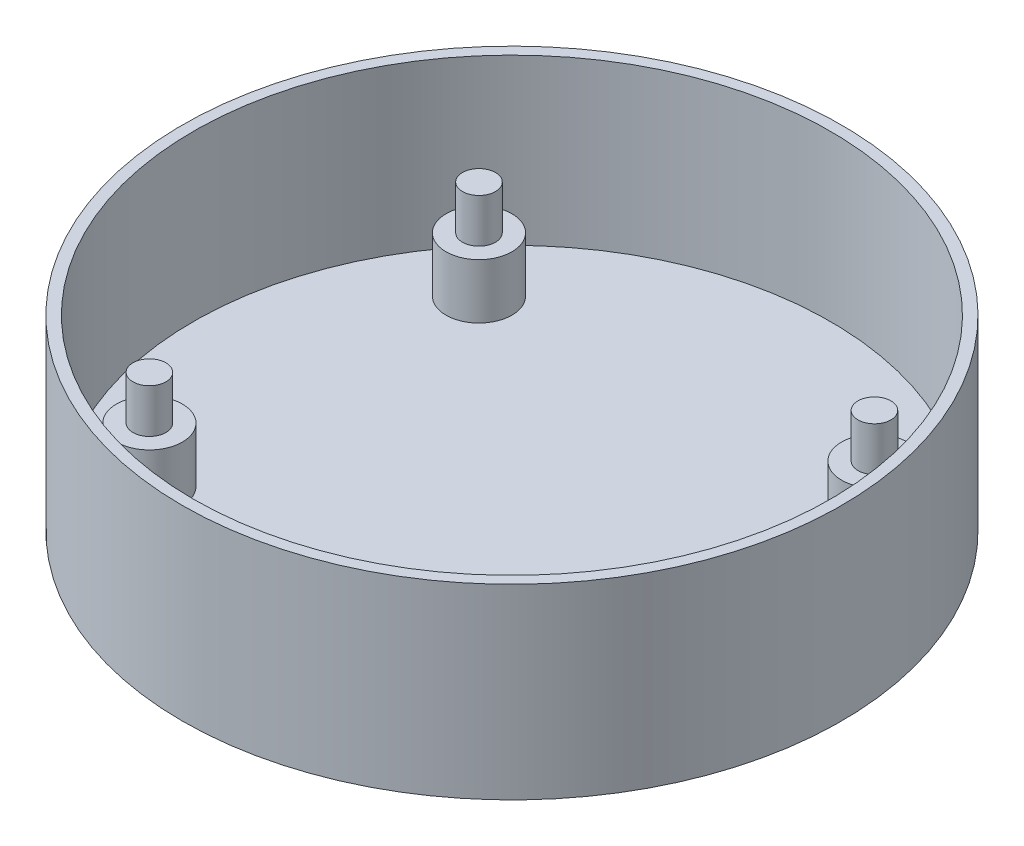
from build123d import *

# Parameters (mm, degrees)
SKETCH1_R           = 30
BOSS_EXTRUDE1_DEPTH = 17
SKETCH2_R           = 29
CUT_EXTRUDE1_DEPTH  = 15
SKETCH3_R           = 3
BOSS_EXTRUDE5_DEPTH = 5
SKETCH4_R           = 1.5
BOSS_EXTRUDE6_DEPTH = 4


with BuildPart() as part:
    # Sketch1 → Boss-Extrude1 (new body)
    with BuildSketch(Plane(origin=(0, 0, 0), x_dir=(1, 0, 0), z_dir=(0, 1, 0))):
        Circle(SKETCH1_R)
    extrude(amount=BOSS_EXTRUDE1_DEPTH)

    # Sketch2 → Cut-Extrude1 (cut)
    with BuildSketch(Plane(origin=(0, 17, 0), x_dir=(1, 0, 0), z_dir=(0, 1, 0))):
        Circle(SKETCH2_R)
    extrude(amount=-CUT_EXTRUDE1_DEPTH, mode=Mode.SUBTRACT)

    # Sketch3 → Boss-Extrude5 (add)
    with BuildSketch(Plane(origin=(0, 2, 0), x_dir=(1, 0, 0), z_dir=(0, 1, 0))):
        with Locations((-18, 15)):
            Circle(SKETCH3_R)
        with Locations((-18, -15)):
            Circle(SKETCH3_R)
        with Locations((18, -15)):
            Circle(SKETCH3_R)
        with Locations((18, 15)):
            Circle(SKETCH3_R)
    extrude(amount=BOSS_EXTRUDE5_DEPTH)

    # Sketch4 → Boss-Extrude6 (add)
    with BuildSketch(Plane(origin=(0, 7, 0), x_dir=(1, 0, 0), z_dir=(0, 1, 0))):
        with Locations((-18, 15)):
            Circle(SKETCH4_R)
        with Locations((-18, -15)):
            Circle(SKETCH4_R)
        with Locations((18, 15)):
            Circle(SKETCH4_R)
        with Locations((18, -15)):
            Circle(SKETCH4_R)
    extrude(amount=BOSS_EXTRUDE6_DEPTH)


solid = part.part
